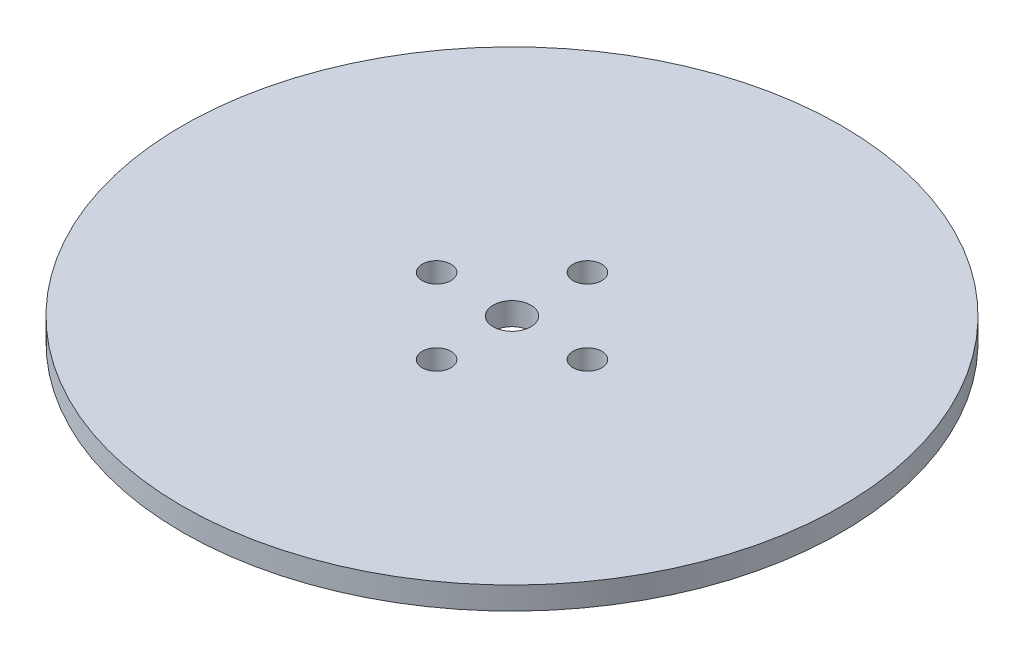
from build123d import *

# Parameters (mm, degrees)
SKETCH1_R           = 87.5
BOSS_EXTRUDE1_DEPTH = 6
SKETCH2_R           = 5
CUT_EXTRUDE1_DEPTH  = 124.889063278
SKETCH3_R           = 3.814039958
CUT_EXTRUDE2_DEPTH  = 5.678140981
CIRPATTERN1_COUNT   = 4


with BuildPart() as part:
    # Sketch1 → Boss-Extrude1 (new body)
    with BuildSketch(Plane(origin=(0, 0, 0), x_dir=(1, 0, 0), z_dir=(0, 1, 0))):
        Circle(SKETCH1_R)
    extrude(amount=BOSS_EXTRUDE1_DEPTH)

    # Sketch2 → Cut-Extrude1 (cut, through all)
    with BuildSketch(Plane(origin=(0, 0, 0), x_dir=(1, 0, 0), z_dir=(0, 1, 0))):
        Circle(SKETCH2_R)
    extrude(amount=CUT_EXTRUDE1_DEPTH, mode=Mode.SUBTRACT)

    # Sketch3 → Cut-Extrude2 (cut)
    with BuildSketch(Plane(origin=(0, 6, 0), x_dir=(1, 0, 0), z_dir=(0, 1, 0))):
        with Locations((-20.029241739, 0)):
            Circle(SKETCH3_R)
    cut_extrude2 = extrude(amount=-CUT_EXTRUDE2_DEPTH, mode=Mode.SUBTRACT)

    # CirPattern1: Cut-Extrude2 ×4 about axis
    cirpattern1_axis = Axis((0, 0, 0), (0, 1, 0))
    for i in range(1, CIRPATTERN1_COUNT):
        add(cut_extrude2.rotate(cirpattern1_axis, i * 360 / CIRPATTERN1_COUNT), mode=Mode.SUBTRACT)


solid = part.part
